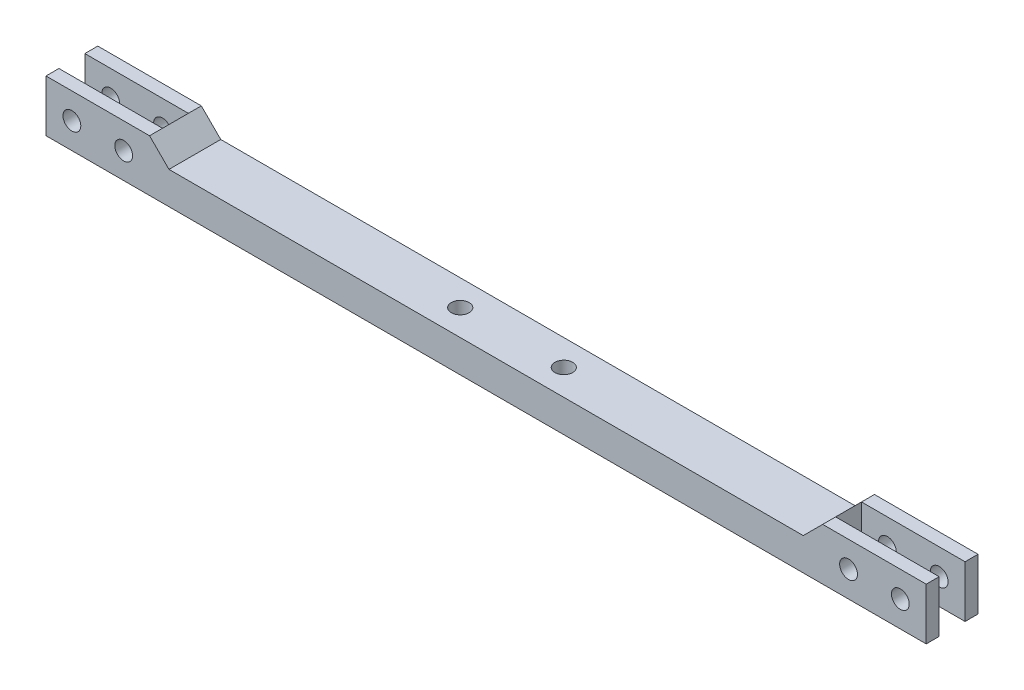
from build123d import *

# Parameters (mm, degrees)
BOSS_EXTRUDE1_DEPTH     = 6.35
CUT_EXTRUDE1_DEPTH      = 109.879819067
CUT_EXTRUDE1_DEPTH_BACK = 109.879819067
SKETCH2_R               = 2.1828125
CUT_EXTRUDE2_DEPTH      = 109.879819067
CUT_EXTRUDE2_DEPTH_BACK = 109.879819067
CUT_EXTRUDE3_DEPTH      = 110.433918417
CUT_EXTRUDE3_DEPTH_BACK = 110.433918417
SKETCH4_R               = 2.1828125


with BuildPart() as part:
    # Sketch1 → Boss-Extrude1 (new, symmetric)
    with BuildSketch(Plane(origin=(0, 0, 0), x_dir=(1, 0, 0), z_dir=(0, 1, 0))):
        Polygon((-107.95, 0), (107.95, 0), (107.95, 3.175), (82.55, 3.175), (82.55, 9.525), (107.95, 9.525), (107.95, 12.7), (-107.95, 12.7), (-107.95, 9.525), (-82.55, 9.525), (-82.55, 3.175), (-107.95, 3.175), align=None)
    extrude(amount=BOSS_EXTRUDE1_DEPTH, both=True)

    # Sketch2 → Cut-Extrude1 (cut, two sides: drawn at the far end of the back side and taken through both)
    with BuildSketch(Plane.XY.offset(-CUT_EXTRUDE1_DEPTH_BACK)):
        with Locations((-101.6, 0)):
            Circle(SKETCH2_R)
        with Locations((-88.9, 0)):
            Circle(SKETCH2_R)
        with Locations((101.6, 0)):
            Circle(SKETCH2_R)
        with Locations((88.9, 0)):
            Circle(SKETCH2_R)
    extrude(amount=CUT_EXTRUDE1_DEPTH + CUT_EXTRUDE1_DEPTH_BACK, mode=Mode.SUBTRACT)

    # Sketch3 → Cut-Extrude2 (cut, two sides: drawn at the far end of the back side and taken through both)
    with BuildSketch(Plane.XY.offset(-CUT_EXTRUDE2_DEPTH_BACK)):
        Polygon((-82.55, 6.35), (-77.7875, 1.5875), (77.7875, 1.5875), (82.55, 6.35), align=None)
    extrude(amount=CUT_EXTRUDE2_DEPTH + CUT_EXTRUDE2_DEPTH_BACK, mode=Mode.SUBTRACT)

    # Sketch4 → Cut-Extrude3 (cut, two sides: drawn at the far end of the back side and taken through both)
    with BuildSketch(Plane.XZ.offset(6.35).offset(-CUT_EXTRUDE3_DEPTH_BACK)):
        with Locations((-12.7, -6.35)):
            Circle(SKETCH4_R)
        with Locations((12.7, -6.35)):
            Circle(SKETCH4_R)
    extrude(amount=CUT_EXTRUDE3_DEPTH + CUT_EXTRUDE3_DEPTH_BACK, mode=Mode.SUBTRACT)


solid = part.part
